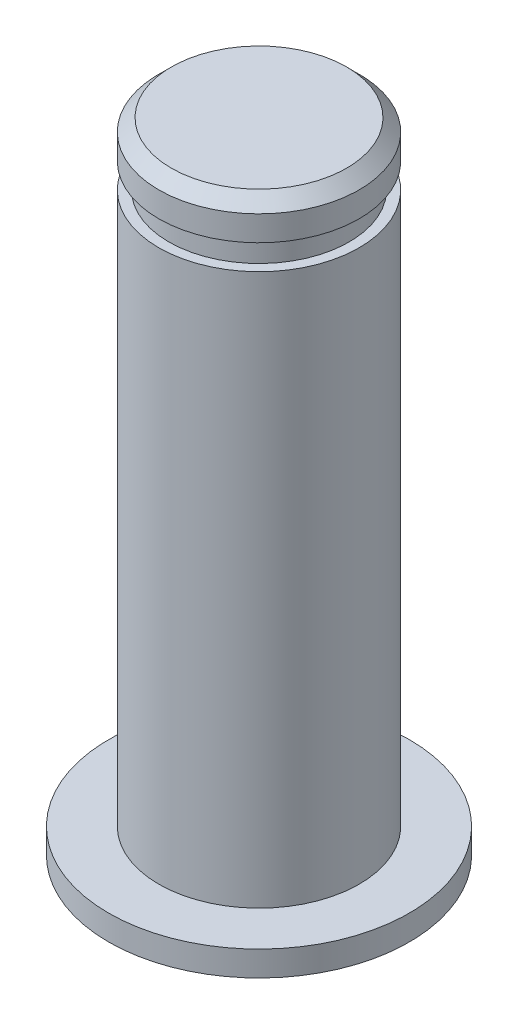
from build123d import *

# Parameters (mm, degrees)
CHAMFER_1_SIZE = 0.5


with BuildPart() as part:
    # Эскиз1 → Повернуть1 (revolve)
    with BuildSketch(Plane.XY):
        Polygon((-4, 25.5), (0, 25.5), (0, 0), (-6, 0), (-6, 1), (-4, 1), (-4, 23), (-3.6, 23), (-3.6, 24), (-4, 24), align=None)
    revolve(axis=Axis((0, 0, 0), (0, -1, 0)))

    # Фаска1
    chamfer_1_edges = [part.edges().sort_by_distance(p)[0] for p in [
        (4, 25.5, 0),
    ]]
    chamfer(chamfer_1_edges, length=CHAMFER_1_SIZE)


solid = part.part
